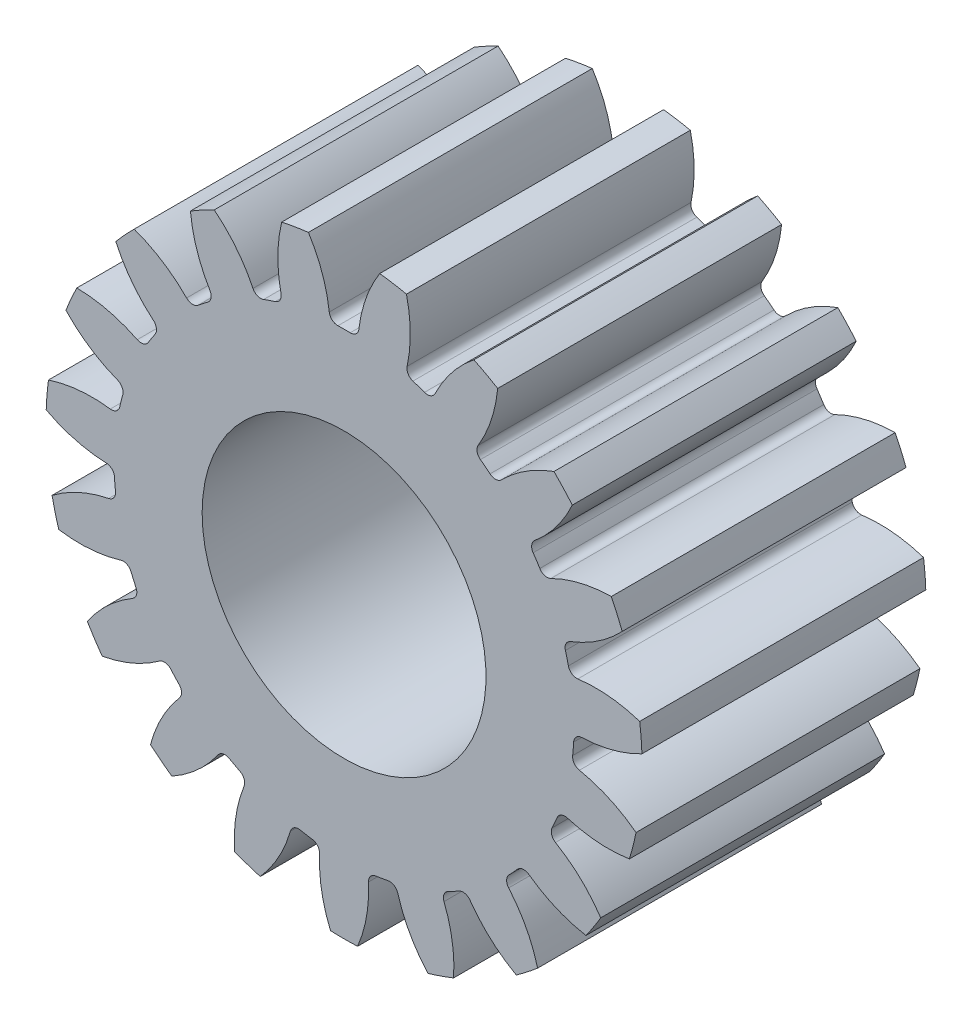
from build123d import *

# Parameters (mm, degrees)
SKETCH2_R                = 10.5
BOSS_EXTRUDE1_DEPTH      = 5
CUT_EXTRUDE1_DEPTH       = 16.668439616
FILLET1_R                = 0.3
CIRPATTERN1_COUNT        = 19
FILLET1_OF_CIRPATTERN1_R = 0.3
SKETCH4_R                = 5
CUT_EXTRUDE3_DEPTH       = 10


with BuildPart() as part:
    # Sketch2 → Boss-Extrude1 (new, symmetric)
    with BuildSketch(Plane.XY):
        Circle(SKETCH2_R)
    extrude(amount=BOSS_EXTRUDE1_DEPTH, both=True)

    # Sketch3 → Cut-Extrude1 (cut, symmetric)
    with BuildSketch(Plane.XY):
        with BuildLine():
            ThreePointArc((0.496686286, 8.084757432), (0, 8.1), (-0.496686286, 8.084757432))
            ThreePointArc((-0.496686286, 8.084757432), (-0.727830795, 9.302840706), (-1.255782118, 10.424634827))
            ThreePointArc((-1.255782118, 10.424634827), (0, 10.5), (1.255782118, 10.424634827))
            ThreePointArc((1.255782118, 10.424634827), (0.727830795, 9.302840706), (0.496686286, 8.084757432))
        make_face()
    cut_extrude1 = extrude(amount=CUT_EXTRUDE1_DEPTH, both=True, mode=Mode.SUBTRACT)

    # Fillet1
    fillet1_edges = [part.edges().sort_by_distance(p)[0] for p in [
        (0.496686286, 8.084757432, 0),
        (-0.496686286, 8.084757432, 0),
    ]]
    fillet(fillet1_edges, radius=FILLET1_R)

    # CirPattern1: Cut-Extrude1 ×19 about axis
    cirpattern1_axis = Axis((0, 0, -11), (0, 0, 1))
    for i in range(1, CIRPATTERN1_COUNT):
        add(cut_extrude1.rotate(cirpattern1_axis, i * 360 / CIRPATTERN1_COUNT), mode=Mode.SUBTRACT)

    # Fillet1 of CirPattern1
    fillet1_of_cirpattern1_edges = [part.edges().sort_by_distance(p)[0] for p in [
        (-2.155341994, 7.807976747, 0),
        (-3.094890899, 7.485429201, 0),
        (-4.573805525, 6.685080629, 0),
        (-5.357716062, 6.074938567, 0),
        (-6.496626258, 4.837752295, 0),
        (-7.039949556, 4.006134078, 0),
        (-7.71543673, 2.466178434, 0),
        (-7.959295279, 1.503202799, 0),
        (-8.098159915, -0.172644127, 0),
        (-8.016127858, -1.162623827, 0),
        (-7.603321817, -2.792758018, 0),
        (-7.2042886, -3.702462122, 0),
        (-6.284545823, -5.110233243, 0),
        (-5.611752887, -5.841081196, 0),
        (-4.284741774, -6.873935404, 0),
        (-3.411096672, -7.346728489, 0),
        (-1.820619469, -7.892740003, 0),
        (-0.840795205, -8.056243754, 0),
        (0.840795205, -8.056243754, 0),
        (1.820619469, -7.892740003, 0),
        (3.411096672, -7.346728489, 0),
        (4.284741774, -6.873935404, 0),
        (5.611752887, -5.841081196, 0),
        (6.284545823, -5.110233243, 0),
        (7.2042886, -3.702462122, 0),
        (7.603321817, -2.792758018, 0),
        (8.016127858, -1.162623827, 0),
        (8.098159915, -0.172644127, 0),
        (7.959295279, 1.503202799, 0),
        (7.71543673, 2.466178434, 0),
        (7.039949556, 4.006134078, 0),
        (6.496626258, 4.837752295, 0),
        (5.357716062, 6.074938567, 0),
        (4.573805525, 6.685080629, 0),
        (3.094890899, 7.485429201, 0),
        (2.155341994, 7.807976747, 0),
    ]]
    fillet(fillet1_of_cirpattern1_edges, radius=FILLET1_OF_CIRPATTERN1_R)

    # Sketch4 → Cut-Extrude3 (cut)
    with BuildSketch(Plane(origin=(0, 0, -5), x_dir=(-1, 0, 0), z_dir=(0, 0, -1))):
        Circle(SKETCH4_R)
    extrude(amount=-CUT_EXTRUDE3_DEPTH, mode=Mode.SUBTRACT)


solid = part.part
